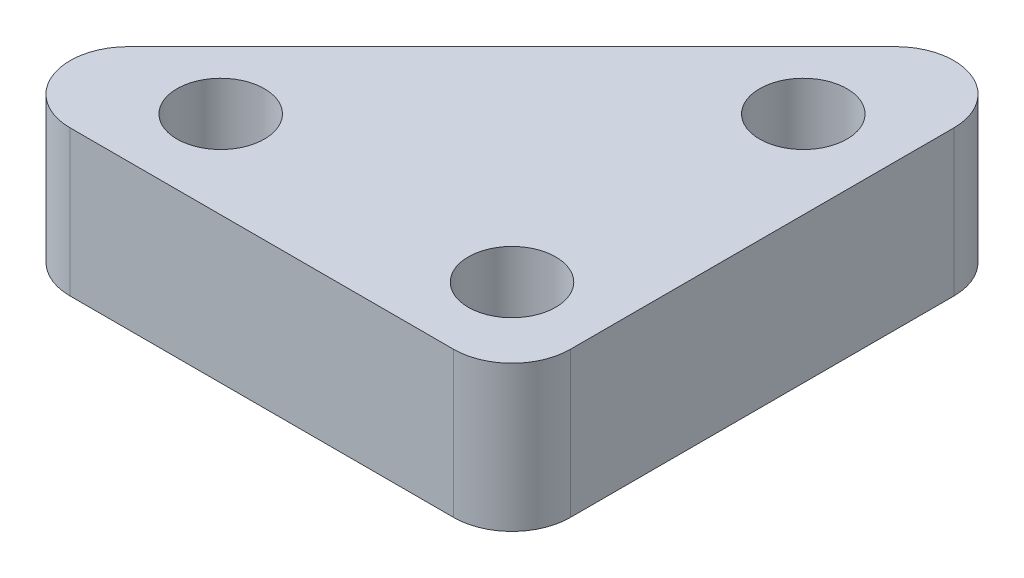
from build123d import *

# Parameters (mm, degrees)
BOSS_EXTRUDE1_DEPTH = 5
FILLET1_R           = 2
SKETCH2_R           = 1.5
CUT_EXTRUDE1_DEPTH  = 24.205715132


with BuildPart() as part:
    # Sketch1 → Boss-Extrude1 (new body)
    with BuildSketch(Plane(origin=(0, 0, 0), x_dir=(1, 0, 0), z_dir=(0, 1, 0))):
        Polygon((-1.043526837, 6.519816127), (-1.043526837, -13.480183873), (-21.043526837, -13.480183873), align=None)
    extrude(amount=BOSS_EXTRUDE1_DEPTH)

    # Fillet1
    fillet1_edges = [part.edges().sort_by_distance(p)[0] for p in [
        (-1.043526837, 2.5, 13.480183873),
        (-21.043526837, 2.5, 13.480183873),
        (-1.043526837, 2.5, -6.519816127),
    ]]
    fillet(fillet1_edges, radius=FILLET1_R)

    # Sketch2 → Cut-Extrude1 (cut, through all)
    with BuildSketch(Plane(origin=(0, 5, 0), x_dir=(1, 0, 0), z_dir=(0, 1, 0))):
        with Locations((-4.043526837, -0.480183873)):
            Circle(SKETCH2_R)
        with Locations((-4.043526837, -10.480183873)):
            Circle(SKETCH2_R)
        with Locations((-14.043526837, -10.480183873)):
            Circle(SKETCH2_R)
    extrude(amount=-CUT_EXTRUDE1_DEPTH, mode=Mode.SUBTRACT)


solid = part.part
